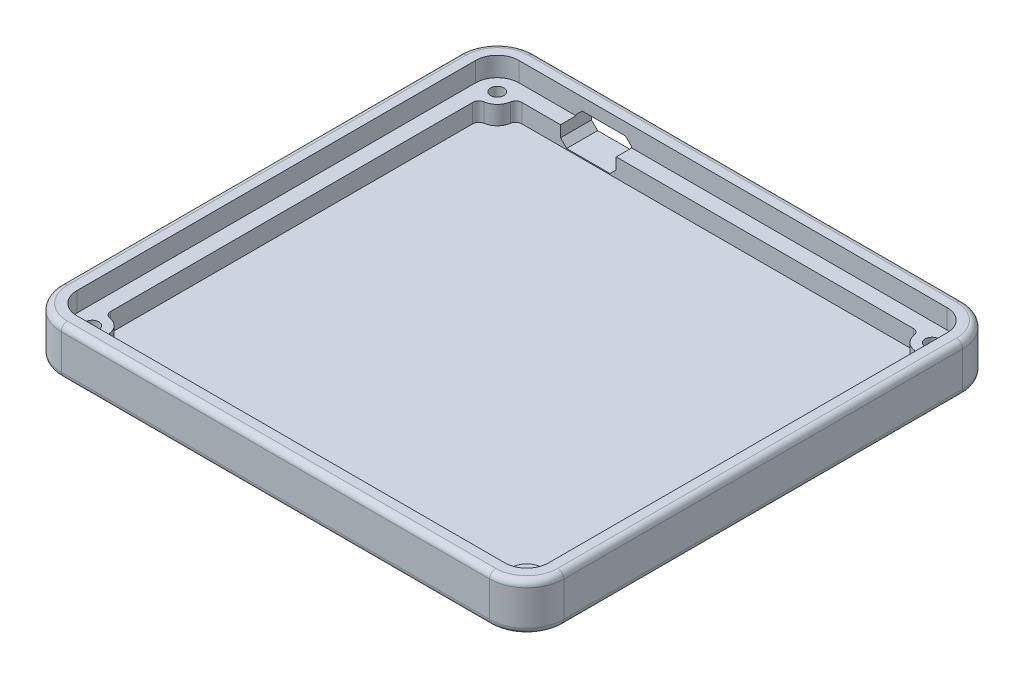
from build123d import *

# Parameters (mm, degrees)
BOSS_EXTRUDE2_DEPTH      = 3
BOSS_EXTRUDE3_DEPTH      = 6
BOSS_EXTRUDE3_DEPTH_BACK = 3
SKETCH3_R                = 2.15
BOSS_EXTRUDE4_DEPTH      = 6.28
CUT_EXTRUDE1_DEPTH       = 10
FILLET1_R                = 2
CUT_EXTRUDE3_DEPTH       = 113.186165145
CUT_EXTRUDE3_DEPTH_BACK  = 113.186165145
SKETCH11_R               = 2.15
CUT_EXTRUDE2_DEPTH       = 4
CUT_EXTRUDE4_DEPTH       = 2
FILLET4_R                = 2


with BuildPart() as part:
    # Sketch2 → Boss-Extrude2 (new body)
    with BuildSketch(Plane(origin=(0, 0, 0), x_dir=(1, 0, 0), z_dir=(0, 1, 0))):
        with BuildLine():
            Line((-69.195, 71.435), (69.195, 71.435))
            ThreePointArc((69.195, 71.435), (74.144747468, 69.384747468), (76.195, 64.435))
            Line((76.195, 64.435), (76.195, -64.435))
            ThreePointArc((76.195, -64.435), (74.144747468, -69.384747468), (69.195, -71.435))
            Line((69.195, -71.435), (-69.195, -71.435))
            ThreePointArc((-69.195, -71.435), (-74.144747468, -69.384747468), (-76.195, -64.435))
            Line((-76.195, -64.435), (-76.195, 64.435))
            ThreePointArc((-76.195, 64.435), (-74.144747468, 69.384747468), (-69.195, 71.435))
        make_face()
    extrude(amount=BOSS_EXTRUDE2_DEPTH)

    # Sketch3 → Boss-Extrude3 (add, two sides: drawn at the far end of the back side and taken through both)
    with BuildSketch(Plane(origin=(0, 3, 0), x_dir=(1, 0, 0), z_dir=(0, 1, 0)).offset(-BOSS_EXTRUDE3_DEPTH_BACK)):
        with BuildLine():
            ThreePointArc((-69.195, 76.435), (-77.680281374, 72.920281374), (-81.195, 64.435))
            Line((-81.195, 64.435), (-81.195, -64.435))
            ThreePointArc((-81.195, -64.435), (-77.680281374, -72.920281374), (-69.195, -76.435))
            Line((-69.195, -76.435), (69.195, -76.435))
            ThreePointArc((69.195, -76.435), (77.680281374, -72.920281374), (81.195, -64.435))
            Line((81.195, -64.435), (81.195, 64.435))
            ThreePointArc((81.195, 64.435), (77.680281374, 72.920281374), (69.195, 76.435))
            Line((69.195, 76.435), (-69.195, 76.435))
        make_face()
        with Locations((-70.2, -65.44)):
            Circle(SKETCH3_R, mode=Mode.SUBTRACT)
        with Locations((70.2, -65.44)):
            Circle(SKETCH3_R, mode=Mode.SUBTRACT)
        with BuildLine():
            Line((-71.195, -60.44), (-71.195, 60.44))
            Line((-71.195, 60.44), (-70.195, 60.44))
            ThreePointArc((-70.195, 60.44), (-66.663001628, 61.903001628), (-65.2, 65.435))
            Line((-65.2, 65.435), (-65.2, 66.435))
            Line((-65.2, 66.435), (65.2, 66.435))
            Line((65.2, 66.435), (65.2, 65.435))
            ThreePointArc((65.2, 65.435), (66.663001628, 61.903001628), (70.195, 60.44))
            Line((70.195, 60.44), (71.195, 60.44))
            Line((71.195, 60.44), (71.195, -60.44))
            Line((71.195, -60.44), (70.195, -60.44))
            ThreePointArc((70.195, -60.44), (66.663001628, -61.903001628), (65.2, -65.435))
            Line((65.2, -65.435), (65.2, -66.435))
            Line((65.2, -66.435), (-65.2, -66.435))
            Line((-65.2, -66.435), (-65.2, -65.435))
            ThreePointArc((-65.2, -65.435), (-66.663001628, -61.903001628), (-70.195, -60.44))
            Line((-70.195, -60.44), (-71.195, -60.44))
        make_face(mode=Mode.SUBTRACT)
        with Locations((-70.2, 65.44)):
            Circle(SKETCH3_R, mode=Mode.SUBTRACT)
        with Locations((70.2, 65.44)):
            Circle(SKETCH3_R, mode=Mode.SUBTRACT)
    extrude(amount=BOSS_EXTRUDE3_DEPTH + BOSS_EXTRUDE3_DEPTH_BACK)

    # Sketch8 → Boss-Extrude4 (add)
    with BuildSketch(Plane(origin=(0, 9, 0), x_dir=(1, 0, 0), z_dir=(0, 1, 0))):
        with BuildLine():
            ThreePointArc((-81.195, -64.435), (-77.680281374, -72.920281374), (-69.195, -76.435))
            Line((-69.195, -76.435), (69.195, -76.435))
            ThreePointArc((69.195, -76.435), (77.680281374, -72.920281374), (81.195, -64.435))
            Line((81.195, -64.435), (81.195, 64.435))
            ThreePointArc((81.195, 64.435), (77.680281374, 72.920281374), (69.195, 76.435))
            Line((69.195, 76.435), (-69.195, 76.435))
            ThreePointArc((-69.195, 76.435), (-77.680281374, 72.920281374), (-81.195, 64.435))
            Line((-81.195, 64.435), (-81.195, -64.435))
        make_face()
        with BuildLine():
            Line((76.195, 64.435), (76.195, -64.435))
            ThreePointArc((76.195, -64.435), (74.144747468, -69.384747468), (69.195, -71.435))
            Line((69.195, -71.435), (-69.195, -71.435))
            ThreePointArc((-69.195, -71.435), (-74.144747468, -69.384747468), (-76.195, -64.435))
            Line((-76.195, -64.435), (-76.195, 64.435))
            ThreePointArc((-76.195, 64.435), (-74.144747468, 69.384747468), (-69.195, 71.435))
            Line((-69.195, 71.435), (69.195, 71.435))
            ThreePointArc((69.195, 71.435), (74.144747468, 69.384747468), (76.195, 64.435))
        make_face(mode=Mode.SUBTRACT)
    extrude(amount=BOSS_EXTRUDE4_DEPTH)

    # Sketch9 → Cut-Extrude1 (cut)
    with BuildSketch(Plane(origin=(0, 0, -76.435), x_dir=(-1, 0, 0), z_dir=(0, 0, -1))):
        Polygon((48.765, 11.345), (34.765, 11.345), (32.765, 9.345), (32.765, 5.345), (34.765, 3.345), (48.765, 3.345), (50.765, 5.345), (50.765, 9.345), align=None)
    extrude(amount=-CUT_EXTRUDE1_DEPTH, mode=Mode.SUBTRACT)

    # Fillet1
    fillet1_edges = [part.edges().sort_by_distance(p)[0] for p in [
        (-65.2, 6, -66.435),
        (-71.195, 6, -60.44),
        (-71.195, 6, 60.44),
        (-65.2, 6, 66.435),
        (71.195, 6, 60.44),
        (65.2, 6, 66.435),
        (65.2, 6, -66.435),
        (71.195, 6, -60.44),
    ]]
    fillet(fillet1_edges, radius=FILLET1_R)

    # Sketch11 → Cut-Extrude3 (cut, two sides: drawn at the far end of the back side and taken through both)
    with BuildSketch(Plane(origin=(0, 3, 0), x_dir=(1, 0, 0), z_dir=(0, 1, 0)).offset(-CUT_EXTRUDE3_DEPTH_BACK)):
        with Locations((-70.2, 65.44)):
            Circle(SKETCH11_R)
        with Locations((70.2, 65.44)):
            Circle(SKETCH11_R)
        with Locations((70.2, -65.496439375)):
            Circle(SKETCH11_R)
        with Locations((-70.2, -65.44)):
            Circle(SKETCH11_R)
    extrude(amount=CUT_EXTRUDE3_DEPTH + CUT_EXTRUDE3_DEPTH_BACK, mode=Mode.SUBTRACT)

    # Sketch10 → Cut-Extrude2 (cut)
    with BuildSketch(Plane.XZ):
        Polygon((66.158548116, 65.44), (68.179274058, 61.94), (72.220725942, 61.94), (74.241451884, 65.44), (72.220725942, 68.94), (68.179274058, 68.94), align=None)
        Polygon((-68.179274058, 61.94), (-66.158548116, 65.44), (-68.179274058, 68.94), (-72.220725942, 68.94), (-74.241451884, 65.44), (-72.220725942, 61.94), align=None)
        Polygon((74.241451884, -65.44), (72.220725942, -61.94), (68.179274058, -61.94), (66.158548116, -65.44), (68.179274058, -68.94), (72.220725942, -68.94), align=None)
        Polygon((-66.158548116, -65.44), (-68.179274058, -61.94), (-72.220725942, -61.94), (-74.241451884, -65.44), (-72.220725942, -68.94), (-68.179274058, -68.94), align=None)
    extrude(amount=-CUT_EXTRUDE2_DEPTH, mode=Mode.SUBTRACT)

    # Sketch12 → Cut-Extrude4 (cut)
    with BuildSketch(Plane.XZ):
        with BuildLine():
            Line((-55, -60), (55, -60))
            ThreePointArc((55, -60), (60, -65), (55, -70))
            Line((55, -70), (-55, -70))
            ThreePointArc((-55, -70), (-60, -65), (-55, -60))
        make_face()
    extrude(amount=-CUT_EXTRUDE4_DEPTH, mode=Mode.SUBTRACT)

    # Fillet4
    fillet4_edges = [part.edges().sort_by_distance(p)[0] for p in [
        (-77.680281374, 0, -72.920281374),
        (0, 0, -76.435),
        (77.680281374, 0, -72.920281374),
        (81.195, 0, 0),
        (77.680281374, 0, 72.920281374),
        (0, 0, 76.435),
        (-77.680281374, 0, 72.920281374),
        (-77.680281374, 15.28, -72.920281374),
        (0, 15.28, -76.435),
        (77.680281374, 15.28, -72.920281374),
        (81.195, 15.28, 0),
        (77.680281374, 15.28, 72.920281374),
        (0, 15.28, 76.435),
        (-77.680281374, 15.28, 72.920281374),
        (-81.195, 0, 0),
        (-81.195, 15.28, 0),
    ]]
    fillet(fillet4_edges, radius=FILLET4_R)


solid = part.part
